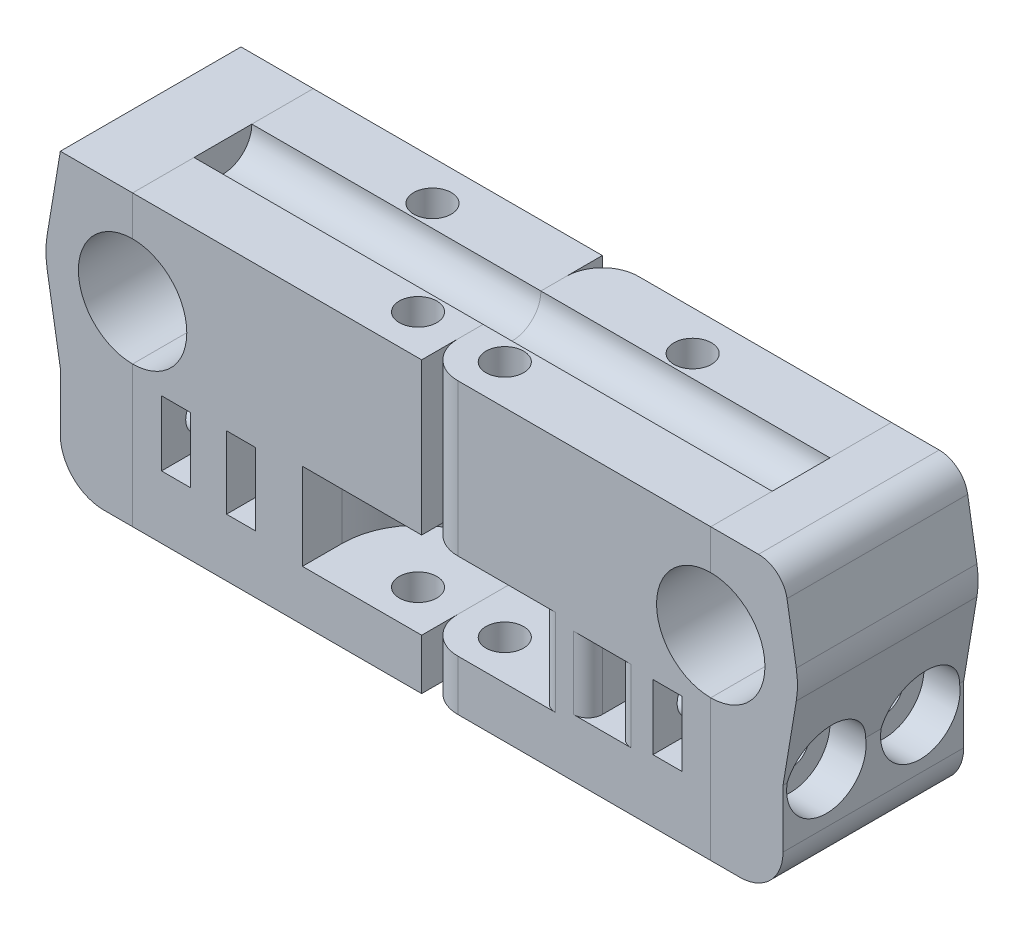
from build123d import *

# Parameters (mm, degrees)
SKETCH1_W               = 50
SKETCH1_H               = 40
SKETCH1_R               = 7.5
BOSS_EXTRUDE1_DEPTH     = 25
SKETCH2_R               = 4
CUT_EXTRUDE1_DEPTH      = 40
SKETCH4_R               = 2.6
CUT_EXTRUDE2_DEPTH      = 54.38539126
BOSS_EXTRUDE2_DEPTH     = 25
SKETCH6_W               = 4
SKETCH6_H               = 10
CUT_EXTRUDE3_DEPTH      = 42.880783183
CUT_EXTRUDE4_START      = -21
CUT_EXTRUDE4_DEPTH      = 12
CUT_EXTRUDE5_START      = -8
CUT_EXTRUDE5_DEPTH      = 12
SKETCH12_R              = 2.65
CUT_EXTRUDE6_DEPTH      = 22
CUT_EXTRUDE7_START      = -14
CUT_EXTRUDE7_DEPTH      = 4
CUT_EXTRUDE8_DEPTH      = 10
CUT_EXTRUDE8_DEPTH_BACK = 5
SKETCH14_R              = 5.5
FILLET6_R               = 6
FILLET1_R               = 5
FILLET2_R               = 2
FILLET3_R               = 4
FILLET4_R               = 5


with BuildPart() as part:
    # Sketch1 → Boss-Extrude1 (new body)
    with BuildSketch(Plane.XY):
        Rectangle(SKETCH1_W, SKETCH1_H)
        with Locations((-15, 7)):
            Circle(SKETCH1_R, mode=Mode.SUBTRACT)
    extrude(amount=BOSS_EXTRUDE1_DEPTH)

    # Sketch2 → Cut-Extrude1 (cut)
    with BuildSketch(Plane(origin=(25, 0, 0), x_dir=(0, 0, -1), z_dir=(1, 0, 0))):
        with Locations((-12.5, 20)):
            Circle(SKETCH2_R)
        with Locations((-12.5, -20)):
            Circle(SKETCH2_R)
    extrude(amount=-CUT_EXTRUDE1_DEPTH, mode=Mode.SUBTRACT)

    # Sketch4 → Cut-Extrude2 (cut, through all)
    with BuildSketch(Plane(origin=(0, 20, 0), x_dir=(1, 0, 0), z_dir=(0, 1, 0))):
        with Locations(Location((7, -5.5, 0), (0, 0, 180))):
            Circle(SKETCH4_R)
        with Locations(Location((19, -19.5, 0), (0, 0, 180))):
            Circle(SKETCH4_R)
    extrude(amount=-CUT_EXTRUDE2_DEPTH, mode=Mode.SUBTRACT)

    # Sketch16 → Boss-Extrude2 (add)
    with BuildSketch(Plane(origin=(0, 0, 0), x_dir=(-1, 0, 0), z_dir=(0, 0, -1))):
        with BuildLine():
            ThreePointArc((26.836925734, 5.028404411), (26.164478755, 2.600634803), (25, 0.366750419))
            Line((25, 0.366750419), (25, -6))
            Line((25, -6), (26.836925734, 5.028404411))
        make_face()
        with BuildLine():
            ThreePointArc((27, 7), (26.959161944, 7.989164089), (26.836925734, 8.971595589))
            ThreePointArc((26.836925734, 8.971595589), (26.164478755, 11.399365197), (25, 13.633249581))
            Line((25, 13.633249581), (25, 0.366750419))
            ThreePointArc((25, 0.366750419), (26.164478755, 2.600634803), (26.836925734, 5.028404411))
            ThreePointArc((26.836925734, 5.028404411), (26.959161944, 6.010835911), (27, 7))
        make_face()
        with BuildLine():
            Line((26.836925734, 8.971595589), (25, 20))
            Line((25, 20), (25, 13.633249581))
            ThreePointArc((25, 13.633249581), (26.164478755, 11.399365197), (26.836925734, 8.971595589))
        make_face()
    extrude(amount=-BOSS_EXTRUDE2_DEPTH)

    # Sketch6 → Cut-Extrude3 (cut, through all)
    with BuildSketch(Plane.XY.offset(25)):
        with Locations((0, -7)):
            Rectangle(SKETCH6_W, SKETCH6_H)
    extrude(amount=-CUT_EXTRUDE3_DEPTH, mode=Mode.SUBTRACT)

    # Sketch8 → Cut-Extrude4 (cut)
    with BuildSketch(Plane(origin=(0, 20, 0), x_dir=(1, 0, 0), z_dir=(0, 1, 0)).offset(CUT_EXTRUDE4_START)):
        with BuildLine():
            Line((19, -9), (29.5, -9))
            Line((29.5, -9), (29.5, -30))
            Line((29.5, -30), (19, -30))
            Line((19, -30), (8.5, -30))
            Line((8.5, -30), (8.5, -19.5))
            ThreePointArc((8.5, -19.5), (11.575378798, -12.075378798), (19, -9))
        make_face()
    extrude(amount=-CUT_EXTRUDE4_DEPTH, mode=Mode.SUBTRACT)

    # Sketch11 → Cut-Extrude5 (cut)
    with BuildSketch(Plane(origin=(0, 20, 0), x_dir=(1, 0, 0), z_dir=(0, 1, 0)).offset(CUT_EXTRUDE5_START)):
        with BuildLine():
            Line((16, -5), (16, -10))
            Line((16, -10), (26.226618187, -10))
            Line((26.226618187, -10), (26.226618187, -16))
            Line((26.226618187, -16), (7, -16))
            ThreePointArc((7, -16), (-0.424621202, -12.924621202), (-3.5, -5.5))
            Line((-3.5, -5.5), (-3.5, 3.5))
            Line((-3.5, 3.5), (16, 3.5))
            Line((16, 3.5), (16, -5))
        make_face()
    extrude(amount=-CUT_EXTRUDE5_DEPTH, mode=Mode.SUBTRACT)

    # Sketch12 → Cut-Extrude6 (cut)
    with BuildSketch(Plane.ZY.offset(25)):
        with Locations((19, -6.86493963)):
            Circle(SKETCH12_R)
        with Locations((6, -6.86493963)):
            Circle(SKETCH12_R)
    extrude(amount=-CUT_EXTRUDE6_DEPTH, mode=Mode.SUBTRACT)

    # Sketch13 → Cut-Extrude7 (cut)
    with BuildSketch(Plane.ZY.offset(25).offset(CUT_EXTRUDE7_START)):
        Polygon((3.613872785, -11.371546229), (8.601890533, -11.371546229), (11.203781066, -6.86493963), (8.601890533, -2.358333032), (6, -2.358333032), (-2.77143087, -2.358333032), (-2.77143087, -11.371546229), align=None)
        Polygon((21.597854006, -2.303110673), (16.297679789, -2.426756953), (13.805260949, -6.986126243), (16.50758116, -11.424308921), (21.136427104, -11.31632387), (27.892847635, -11.31632387), (27.892847635, -2.303110673), align=None)
    extrude(amount=-CUT_EXTRUDE7_DEPTH, mode=Mode.SUBTRACT)

    # Sketch14 → Cut-Extrude8 (cut, two sides: drawn at the far end of the back side and taken through both)
    with BuildSketch(Plane.ZY.offset(25).offset(-CUT_EXTRUDE8_DEPTH_BACK)):
        with Locations(Location((6, -6.86493963, 0), (0, 0, 170.952005971))):
            Circle(SKETCH14_R)
        with Locations(Location((19, -6.86493963, 0), (0, 0, 170.952005971))):
            Circle(SKETCH14_R)
    extrude(amount=CUT_EXTRUDE8_DEPTH + CUT_EXTRUDE8_DEPTH_BACK, mode=Mode.SUBTRACT)


with BuildPart() as body_2:
    # Split1: the piece on the far side of the plane
    add(part.part)
    split(bisect_by=Plane(origin=(-15, 0, 0), x_dir=(0, 0, -1), z_dir=(-1, 0, 0)), keep=Keep.BOTTOM)


with BuildPart() as part_1:
    add(part.part)

    # Split1
    split(bisect_by=Plane(origin=(-15, 0, 0), x_dir=(0, 0, -1), z_dir=(-1, 0, 0)), keep=Keep.TOP)

    # Fillet6
    fillet6_edges = [part_1.edges().sort_by_distance(p)[0] for p in [
        (-25, -20, 12.5),
    ]]
    fillet(fillet6_edges, radius=FILLET6_R)


with BuildPart() as body_3:
    # Mirror1: mirrored copy
    add(body_2.part.mirror(Plane(origin=(25, 0, 25), x_dir=(0, 0, 1), z_dir=(-1, 0, 0))))

    # Fillet1
    fillet1_edges = [body_3.edges().sort_by_distance(p)[0] for p in [
        (25, 0, 0),
        (25, 9.5, 25),
        (25, -16.5, 25),
    ]]
    fillet(fillet1_edges, radius=FILLET1_R)

    # Fillet2
    fillet2_edges = [body_3.edges().sort_by_distance(p)[0] for p in [
        (48, -7, 25),
        (52, -7, 25),
        (48, -7, 0),
        (52, -7, 0),
        (41.5, -7, 25),
        (34, 6, 0),
        (53.5, 6, 0),
        (25, 6, 16),
        (25, 6, 10),
    ]]
    fillet(fillet2_edges, radius=FILLET2_R)

    # Fillet4
    # the kernel refuses this fillet: 5 mm, written as the material it takes off along each edge
    with BuildSketch(Plane(origin=(25, -13, 9), x_dir=(1, 0, 0), z_dir=(0, 1, 0))) as fillet4_piece_1:
        with BuildLine():
            CenterArc((FILLET4_R, FILLET4_R), FILLET4_R, 180, 90)
            Line((0, FILLET4_R), (0, 0))
            Line((0, 0), (FILLET4_R, 0))
        make_face()
    extrude(amount=12, mode=Mode.SUBTRACT)


with BuildPart() as body_4:
    # Mirror1 2: mirrored copy
    add(part_1.part.mirror(Plane(origin=(25, 0, 25), x_dir=(0, 0, 1), z_dir=(-1, 0, 0))))

    # Fillet3
    fillet3_edges = [body_4.edges().sort_by_distance(p)[0] for p in [
        (75, 20, 12.5),
    ]]
    fillet(fillet3_edges, radius=FILLET3_R)


solid = Compound([body_2.part, part_1.part, body_3.part, body_4.part])
